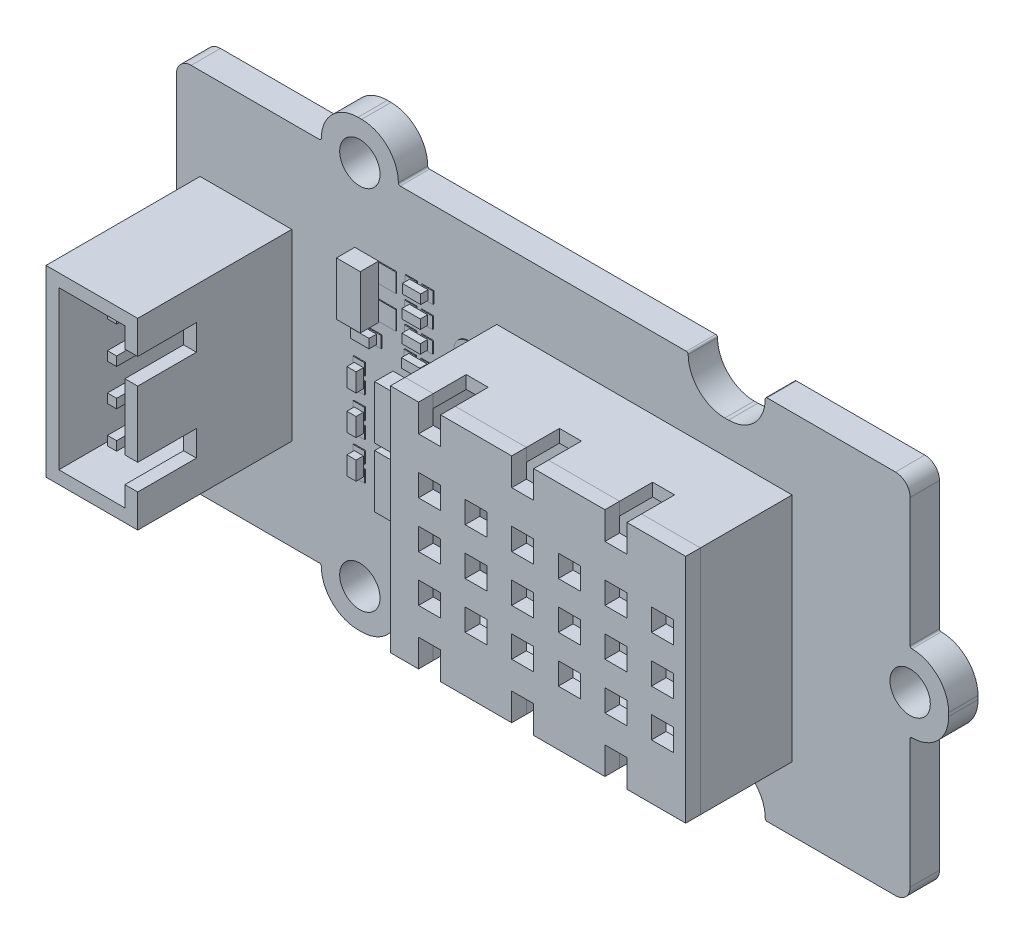
from build123d import *

# Parameters (mm, degrees)
ESQUISSE1_R                            = 1.1
ESQUISSE1_R_2                          = 0.4
ESQUISSE1_R_3                          = 0.4445
PCB_EAGLE_V2_1_EP_ESTIMEE_1_6_DEPTH    = 1.6
GROVE_VERTICAL_H_ESTIMEE_START         = 1.6
ESQUISSE2_W                            = 5
ESQUISSE2_H                            = 10
GROVE_VERTICAL_H_ESTIMEE_DEPTH         = 8.4
CAVITE_GROVE_START                     = 10
ESQUISSE3_W                            = 3.6
ESQUISSE3_H                            = 8.6
CAVITE_GROVE_DEPTH                     = 7.3
DETROMPEURS_GROVE_START                = 10
ESQUISSE4_W                            = 1
ESQUISSE4_H                            = 1.4
DETROMPEURS_GROVE_DEPTH                = 3.2
CONTACTS_GROVE_START                   = -0.8
ESQUISSE5_W                            = 0.5
ESQUISSE5_H                            = 0.5
CONTACTS_GROVE_DEPTH                   = 9.4
CONTACTS_GROVE_2_DEPTH                 = 9.4
CONTACTS_GROVE_3_DEPTH                 = 9.4
CONTACTS_GROVE_4_DEPTH                 = 9.4
DHT20_ENVELOPPE_16_1X12_6X5_8_START    = 1.8
ESQUISSE6_W                            = 16.1
ESQUISSE6_H                            = 12.6
DHT20_ENVELOPPE_16_1X12_6X5_8_DEPTH    = 5
DHT20_INTERIEUR_SIMPLIFIE_START        = 6.8
ESQUISSE7_W                            = 14.7
ESQUISSE7_H                            = 11.2
DHT20_INTERIEUR_SIMPLIFIE_DEPTH        = 4.4
DHT20_GRILLE_AERATION_SIMPLIFIEE_START = 6.8
ESQUISSE8_W                            = 16.1
ESQUISSE8_H                            = 12.6
ESQUISSE8_W_2                          = 1.2
ESQUISSE8_H_2                          = 1.2
DHT20_GRILLE_AERATION_SIMPLIFIEE_DEPTH = 0.8
DHT20_ENCOCHES_LATERALES_START         = 7.6
ESQUISSE9_W                            = 1.2
ESQUISSE9_H                            = 1.6
DHT20_ENCOCHES_LATERALES_DEPTH         = 2.6
PATTES_DHT20_HORIZONTALES_START        = 4.05
ESQUISSE10_W                           = 1.979
ESQUISSE10_H                           = 0.5
PATTES_DHT20_HORIZONTALES_DEPTH        = 0.3
PATTES_DHT20_HORIZONTALES_2_DEPTH      = 0.3
PATTES_DHT20_HORIZONTALES_3_DEPTH      = 0.3
PATTES_DHT20_HORIZONTALES_4_DEPTH      = 0.3
PATTES_DHT20_TRAVERSANTES_START        = -0.8
ESQUISSE11_W                           = 0.5
ESQUISSE11_H                           = 0.5
PATTES_DHT20_TRAVERSANTES_DEPTH        = 4.85
PATTES_DHT20_TRAVERSANTES_2_DEPTH      = 4.85
PATTES_DHT20_TRAVERSANTES_3_DEPTH      = 4.85
PATTES_DHT20_TRAVERSANTES_4_DEPTH      = 4.85
U14_POSITION_EAGLE_START               = 1.65
ESQUISSE12_W                           = 1.3
ESQUISSE12_H                           = 2.9
U14_POSITION_EAGLE_DEPTH               = 1
C62_POSITION_EAGLE_START               = 1.65
ESQUISSE13_W                           = 1
ESQUISSE13_H                           = 0.5
C62_POSITION_EAGLE_DEPTH               = 0.4
C65_POSITION_EAGLE_START               = 1.65
ESQUISSE14_W                           = 1
ESQUISSE14_H                           = 0.5
C65_POSITION_EAGLE_DEPTH               = 0.4
Q12_POSITION_EAGLE_START               = 1.65
ESQUISSE15_W                           = 1.3
ESQUISSE15_H                           = 2.9
Q12_POSITION_EAGLE_DEPTH               = 1
Q13_POSITION_EAGLE_START               = 1.65
ESQUISSE16_W                           = 1.3
ESQUISSE16_H                           = 2.9
Q13_POSITION_EAGLE_DEPTH               = 1
R65_POSITION_EAGLE_START               = 1.65
ESQUISSE17_W                           = 0.5
ESQUISSE17_H                           = 1
R65_POSITION_EAGLE_DEPTH               = 0.4
R66_POSITION_EAGLE_START               = 1.65
ESQUISSE18_W                           = 1
ESQUISSE18_H                           = 0.5
R66_POSITION_EAGLE_DEPTH               = 0.4
R67_POSITION_EAGLE_START               = 1.65
ESQUISSE19_W                           = 0.5
ESQUISSE19_H                           = 1
R67_POSITION_EAGLE_DEPTH               = 0.4
R68_POSITION_EAGLE_START               = 1.65
ESQUISSE20_W                           = 0.5
ESQUISSE20_H                           = 1
R68_POSITION_EAGLE_DEPTH               = 0.4
R53_POSITION_EAGLE_START               = 1.65
ESQUISSE21_W                           = 1
ESQUISSE21_H                           = 0.5
R53_POSITION_EAGLE_DEPTH               = 0.4
C54_POSITION_EAGLE_START               = 1.65
ESQUISSE22_W                           = 1
ESQUISSE22_H                           = 0.5
C54_POSITION_EAGLE_DEPTH               = 0.4
ANNEAU_J8_0_START                      = 1.6
ESQUISSE23_R                           = 0.635
ESQUISSE23_R_2                         = 0.4
ANNEAU_J8_0_DEPTH                      = 0.05
ANNEAU_J8_1_START                      = 1.6
ESQUISSE24_R                           = 0.635
ESQUISSE24_R_2                         = 0.4
ANNEAU_J8_1_DEPTH                      = 0.05
ANNEAU_J8_2_START                      = 1.6
ESQUISSE25_R                           = 0.635
ESQUISSE25_R_2                         = 0.4
ANNEAU_J8_2_DEPTH                      = 0.05
ANNEAU_J8_3_START                      = 1.6
ESQUISSE26_R                           = 0.635
ESQUISSE26_R_2                         = 0.4
ANNEAU_J8_3_DEPTH                      = 0.05
ANNEAU_U11_0_START                     = 1.6
ESQUISSE27_R                           = 0.762
ESQUISSE27_R_2                         = 0.4445
ANNEAU_U11_0_DEPTH                     = 0.05
ANNEAU_U11_1_START                     = 1.6
ESQUISSE28_R                           = 0.762
ESQUISSE28_R_2                         = 0.4445
ANNEAU_U11_1_DEPTH                     = 0.05
ANNEAU_U11_2_START                     = 1.6
ESQUISSE29_R                           = 0.762
ESQUISSE29_R_2                         = 0.4445
ANNEAU_U11_2_DEPTH                     = 0.05
ANNEAU_U11_3_START                     = 1.6
ESQUISSE30_R                           = 0.762
ESQUISSE30_R_2                         = 0.4445
ANNEAU_U11_3_DEPTH                     = 0.05
PAD_U14_0_START                        = 1.6
ESQUISSE31_W                           = 1.143
ESQUISSE31_H                           = 1.016
PAD_U14_0_DEPTH                        = 0.05
PAD_U14_1_START                        = 1.6
ESQUISSE32_W                           = 1.143
ESQUISSE32_H                           = 1.016
PAD_U14_1_DEPTH                        = 0.05
PAD_U14_2_START                        = 1.6
ESQUISSE33_W                           = 1.143
ESQUISSE33_H                           = 1.016
PAD_U14_2_DEPTH                        = 0.05
PAD_C62_0_START                        = 1.6
ESQUISSE34_W                           = 0.635
ESQUISSE34_H                           = 0.635
PAD_C62_0_DEPTH                        = 0.05
PAD_C62_1_START                        = 1.6
ESQUISSE35_W                           = 0.635
ESQUISSE35_H                           = 0.635
PAD_C62_1_DEPTH                        = 0.05
PAD_C65_0_START                        = 1.6
ESQUISSE36_W                           = 0.635
ESQUISSE36_H                           = 0.635
PAD_C65_0_DEPTH                        = 0.05
PAD_C65_1_START                        = 1.6
ESQUISSE37_W                           = 0.635
ESQUISSE37_H                           = 0.635
PAD_C65_1_DEPTH                        = 0.05
PAD_Q12_0_START                        = 1.6
ESQUISSE38_W                           = 1.143
ESQUISSE38_H                           = 1.016
PAD_Q12_0_DEPTH                        = 0.05
PAD_Q12_1_START                        = 1.6
ESQUISSE39_W                           = 1.143
ESQUISSE39_H                           = 1.016
PAD_Q12_1_DEPTH                        = 0.05
PAD_Q12_2_START                        = 1.6
ESQUISSE40_W                           = 1.143
ESQUISSE40_H                           = 1.016
PAD_Q12_2_DEPTH                        = 0.05
PAD_Q13_0_START                        = 1.6
ESQUISSE41_W                           = 1.143
ESQUISSE41_H                           = 1.016
PAD_Q13_0_DEPTH                        = 0.05
PAD_Q13_1_START                        = 1.6
ESQUISSE42_W                           = 1.143
ESQUISSE42_H                           = 1.016
PAD_Q13_1_DEPTH                        = 0.05
PAD_Q13_2_START                        = 1.6
ESQUISSE43_W                           = 1.143
ESQUISSE43_H                           = 1.016
PAD_Q13_2_DEPTH                        = 0.05
PAD_R65_0_START                        = 1.6
ESQUISSE44_W                           = 0.635
ESQUISSE44_H                           = 0.635
PAD_R65_0_DEPTH                        = 0.05
PAD_R65_1_START                        = 1.6
ESQUISSE45_W                           = 0.635
ESQUISSE45_H                           = 0.635
PAD_R65_1_DEPTH                        = 0.05
PAD_R66_0_START                        = 1.6
ESQUISSE46_W                           = 0.635
ESQUISSE46_H                           = 0.635
PAD_R66_0_DEPTH                        = 0.05
PAD_R66_1_START                        = 1.6
ESQUISSE47_W                           = 0.635
ESQUISSE47_H                           = 0.635
PAD_R66_1_DEPTH                        = 0.05
PAD_R67_0_START                        = 1.6
ESQUISSE48_W                           = 0.635
ESQUISSE48_H                           = 0.635
PAD_R67_0_DEPTH                        = 0.05
PAD_R67_1_START                        = 1.6
ESQUISSE49_W                           = 0.635
ESQUISSE49_H                           = 0.635
PAD_R67_1_DEPTH                        = 0.05
PAD_R68_0_START                        = 1.6
ESQUISSE50_W                           = 0.635
ESQUISSE50_H                           = 0.635
PAD_R68_0_DEPTH                        = 0.05
PAD_R68_1_START                        = 1.6
ESQUISSE51_W                           = 0.635
ESQUISSE51_H                           = 0.635
PAD_R68_1_DEPTH                        = 0.05
PAD_R53_0_START                        = 1.6
ESQUISSE52_W                           = 0.635
ESQUISSE52_H                           = 0.635
PAD_R53_0_DEPTH                        = 0.05
PAD_R53_1_START                        = 1.6
ESQUISSE53_W                           = 0.635
ESQUISSE53_H                           = 0.635
PAD_R53_1_DEPTH                        = 0.05
PAD_C54_0_START                        = 1.6
ESQUISSE54_W                           = 0.635
ESQUISSE54_H                           = 0.635
PAD_C54_0_DEPTH                        = 0.05
PAD_C54_1_START                        = 1.6
ESQUISSE55_W                           = 0.635
ESQUISSE55_H                           = 0.635
PAD_C54_1_DEPTH                        = 0.05


with BuildPart() as part:
    # Esquisse1 → PCB_Eagle_V2_1_ep_ESTIMEE_1_6 (new body)
    with BuildSketch(Plane.XY):
        with BuildLine():
            Line((-12.2, 10), (-19.2, 10))
            ThreePointArc((-19.2, 10), (-19.765685425, 9.765685425), (-20, 9.2))
            Line((-20, 9.2), (-20, 2.2))
            ThreePointArc((-20, 2.2), (-19.970710678, 2.129289322), (-19.9, 2.1))
            ThreePointArc((-19.9, 2.1), (-18.485786438, 1.514213562), (-17.9, 0.1))
            Line((-17.9, 0.1), (-17.9, -0.1))
            ThreePointArc((-17.9, -0.1), (-18.485786438, -1.514213562), (-19.9, -2.1))
            ThreePointArc((-19.9, -2.1), (-19.970710678, -2.129289322), (-20, -2.2))
            Line((-20, -2.2), (-20, -9.2))
            ThreePointArc((-20, -9.2), (-19.765685425, -9.765685425), (-19.2, -10))
            Line((-19.2, -10), (-12.2, -10))
            ThreePointArc((-12.2, -10), (-12.129289322, -10.029289322), (-12.1, -10.1))
            ThreePointArc((-12.1, -10.1), (-11.514213562, -11.514213562), (-10.1, -12.1))
            Line((-10.1, -12.1), (-9.9, -12.1))
            ThreePointArc((-9.9, -12.1), (-8.485786438, -11.514213562), (-7.9, -10.1))
            ThreePointArc((-7.9, -10.1), (-7.870710678, -10.029289322), (-7.8, -10))
            Line((-7.8, -10), (7.8, -10))
            ThreePointArc((7.8, -10), (7.870710678, -9.970710678), (7.9, -9.9))
            ThreePointArc((7.9, -9.9), (8.485786438, -8.485786438), (9.9, -7.9))
            Line((9.9, -7.9), (10.1, -7.9))
            ThreePointArc((10.1, -7.9), (11.514213562, -8.485786438), (12.1, -9.9))
            ThreePointArc((12.1, -9.9), (12.129289322, -9.970710678), (12.2, -10))
            Line((12.2, -10), (19.2, -10))
            ThreePointArc((19.2, -10), (19.765685425, -9.765685425), (20, -9.2))
            Line((20, -9.2), (20, -2.2))
            ThreePointArc((20, -2.2), (20.029289322, -2.129289322), (20.1, -2.1))
            ThreePointArc((20.1, -2.1), (21.514213562, -1.514213562), (22.1, -0.1))
            Line((22.1, -0.1), (22.1, 0.1))
            ThreePointArc((22.1, 0.1), (21.514213562, 1.514213562), (20.1, 2.1))
            ThreePointArc((20.1, 2.1), (20.029289322, 2.129289322), (20, 2.2))
            Line((20, 2.2), (20, 9.2))
            ThreePointArc((20, 9.2), (19.765685425, 9.765685425), (19.2, 10))
            Line((19.2, 10), (12.2, 10))
            ThreePointArc((12.2, 10), (12.129289322, 9.970710678), (12.1, 9.9))
            ThreePointArc((12.1, 9.9), (11.514213562, 8.485786438), (10.1, 7.9))
            Line((10.1, 7.9), (9.9, 7.9))
            ThreePointArc((9.9, 7.9), (8.485786438, 8.485786438), (7.9, 9.9))
            ThreePointArc((7.9, 9.9), (7.870710678, 9.970710678), (7.8, 10))
            Line((7.8, 10), (-7.8, 10))
            ThreePointArc((-7.8, 10), (-7.870710678, 10.029289322), (-7.9, 10.1))
            ThreePointArc((-7.9, 10.1), (-8.485786438, 11.514213562), (-9.9, 12.1))
            Line((-9.9, 12.1), (-10.1, 12.1))
            ThreePointArc((-10.1, 12.1), (-11.514213562, 11.514213562), (-12.1, 10.1))
            ThreePointArc((-12.1, 10.1), (-12.129289322, 10.029289322), (-12.2, 10))
        make_face()
        with Locations((-10, -10)):
            Circle(ESQUISSE1_R, mode=Mode.SUBTRACT)
        with Locations((-10, 10)):
            Circle(ESQUISSE1_R, mode=Mode.SUBTRACT)
        with Locations((20, 0)):
            Circle(ESQUISSE1_R, mode=Mode.SUBTRACT)
        with Locations((-16.51, -3)):
            Circle(ESQUISSE1_R_2, mode=Mode.SUBTRACT)
        with Locations((-16.51, -1)):
            Circle(ESQUISSE1_R_2, mode=Mode.SUBTRACT)
        with Locations((-16.51, 1)):
            Circle(ESQUISSE1_R_2, mode=Mode.SUBTRACT)
        with Locations((-16.51, 3)):
            Circle(ESQUISSE1_R_2, mode=Mode.SUBTRACT)
        with Locations((-4.064, 3.81)):
            Circle(ESQUISSE1_R_3, mode=Mode.SUBTRACT)
        with Locations((-4.064, 1.27)):
            Circle(ESQUISSE1_R_3, mode=Mode.SUBTRACT)
        with Locations((-4.064, -1.27)):
            Circle(ESQUISSE1_R_3, mode=Mode.SUBTRACT)
        with Locations((-4.064, -3.81)):
            Circle(ESQUISSE1_R_3, mode=Mode.SUBTRACT)
    extrude(amount=PCB_EAGLE_V2_1_EP_ESTIMEE_1_6_DEPTH)


with BuildPart() as body_2:
    # Esquisse2 → Grove_vertical_H_ESTIMEE (new body)
    with BuildSketch(Plane.XY.offset(GROVE_VERTICAL_H_ESTIMEE_START)):
        with Locations((-16.21, 0)):
            Rectangle(ESQUISSE2_W, ESQUISSE2_H)
    extrude(amount=GROVE_VERTICAL_H_ESTIMEE_DEPTH)

    # Esquisse3 → Cavite_Grove (cut)
    with BuildSketch(Plane.XY.offset(CAVITE_GROVE_START)):
        with Locations((-16.21, 0)):
            Rectangle(ESQUISSE3_W, ESQUISSE3_H)
    extrude(amount=-CAVITE_GROVE_DEPTH, mode=Mode.SUBTRACT)

    # Esquisse4 → Detrompeurs_Grove (cut)
    with BuildSketch(Plane.XY.offset(DETROMPEURS_GROVE_START)):
        with Locations((-14.01, -2.5)):
            Rectangle(ESQUISSE4_W, ESQUISSE4_H)
        with Locations((-14.01, 2.5)):
            Rectangle(ESQUISSE4_W, ESQUISSE4_H)
    extrude(amount=-DETROMPEURS_GROVE_DEPTH, mode=Mode.SUBTRACT)


with BuildPart() as body_3:
    # Esquisse5 → Contacts_Grove (new body)
    with BuildSketch(Plane.XY.offset(CONTACTS_GROVE_START)):
        with Locations((-16.51, -3)):
            Rectangle(ESQUISSE5_W, ESQUISSE5_H)
    extrude(amount=CONTACTS_GROVE_DEPTH)


with BuildPart() as body_4:
    # Esquisse5 → Contacts_Grove 2 (new body)
    with BuildSketch(Plane.XY.offset(CONTACTS_GROVE_START)):
        with Locations((-16.51, -1)):
            Rectangle(ESQUISSE5_W, ESQUISSE5_H)
    extrude(amount=CONTACTS_GROVE_2_DEPTH)


with BuildPart() as body_5:
    # Esquisse5 → Contacts_Grove 3 (new body)
    with BuildSketch(Plane.XY.offset(CONTACTS_GROVE_START)):
        with Locations((-16.51, 1)):
            Rectangle(ESQUISSE5_W, ESQUISSE5_H)
    extrude(amount=CONTACTS_GROVE_3_DEPTH)


with BuildPart() as body_6:
    # Esquisse5 → Contacts_Grove 4 (new body)
    with BuildSketch(Plane.XY.offset(CONTACTS_GROVE_START)):
        with Locations((-16.51, 3)):
            Rectangle(ESQUISSE5_W, ESQUISSE5_H)
    extrude(amount=CONTACTS_GROVE_4_DEPTH)


with BuildPart() as body_7:
    # Esquisse6 → DHT20_enveloppe_16_1x12_6x5_8 (new body)
    with BuildSketch(Plane.XY.offset(DHT20_ENVELOPPE_16_1X12_6X5_8_START)):
        with Locations((5.715, 0)):
            Rectangle(ESQUISSE6_W, ESQUISSE6_H)
    extrude(amount=DHT20_ENVELOPPE_16_1X12_6X5_8_DEPTH)

    # Esquisse7 → DHT20_interieur_simplifie (cut)
    with BuildSketch(Plane.XY.offset(DHT20_INTERIEUR_SIMPLIFIE_START)):
        with Locations((5.715, 0)):
            Rectangle(ESQUISSE7_W, ESQUISSE7_H)
    extrude(amount=-DHT20_INTERIEUR_SIMPLIFIE_DEPTH, mode=Mode.SUBTRACT)


with BuildPart() as body_8:
    # Esquisse8 → DHT20_grille_aeration_simplifiee (new body)
    with BuildSketch(Plane.XY.offset(DHT20_GRILLE_AERATION_SIMPLIFIEE_START)):
        with Locations((5.715, 0)):
            Rectangle(ESQUISSE8_W, ESQUISSE8_H)
        with Locations((-0.2, -2.7)):
            Rectangle(ESQUISSE8_W_2, ESQUISSE8_H_2, mode=Mode.SUBTRACT)
        with Locations((-0.2, -0.16)):
            Rectangle(ESQUISSE8_W_2, ESQUISSE8_H_2, mode=Mode.SUBTRACT)
        with Locations((-0.2, 2.38)):
            Rectangle(ESQUISSE8_W_2, ESQUISSE8_H_2, mode=Mode.SUBTRACT)
        with Locations((2.34, -2.7)):
            Rectangle(ESQUISSE8_W_2, ESQUISSE8_H_2, mode=Mode.SUBTRACT)
        with Locations((2.34, -0.16)):
            Rectangle(ESQUISSE8_W_2, ESQUISSE8_H_2, mode=Mode.SUBTRACT)
        with Locations((2.34, 2.38)):
            Rectangle(ESQUISSE8_W_2, ESQUISSE8_H_2, mode=Mode.SUBTRACT)
        with Locations((4.88, -2.7)):
            Rectangle(ESQUISSE8_W_2, ESQUISSE8_H_2, mode=Mode.SUBTRACT)
        with Locations((4.88, -0.16)):
            Rectangle(ESQUISSE8_W_2, ESQUISSE8_H_2, mode=Mode.SUBTRACT)
        with Locations((4.88, 2.38)):
            Rectangle(ESQUISSE8_W_2, ESQUISSE8_H_2, mode=Mode.SUBTRACT)
        with Locations((7.42, -2.7)):
            Rectangle(ESQUISSE8_W_2, ESQUISSE8_H_2, mode=Mode.SUBTRACT)
        with Locations((7.42, -0.16)):
            Rectangle(ESQUISSE8_W_2, ESQUISSE8_H_2, mode=Mode.SUBTRACT)
        with Locations((7.42, 2.38)):
            Rectangle(ESQUISSE8_W_2, ESQUISSE8_H_2, mode=Mode.SUBTRACT)
        with Locations((9.96, -2.7)):
            Rectangle(ESQUISSE8_W_2, ESQUISSE8_H_2, mode=Mode.SUBTRACT)
        with Locations((9.96, -0.16)):
            Rectangle(ESQUISSE8_W_2, ESQUISSE8_H_2, mode=Mode.SUBTRACT)
        with Locations((9.96, 2.38)):
            Rectangle(ESQUISSE8_W_2, ESQUISSE8_H_2, mode=Mode.SUBTRACT)
        with Locations((12.5, -2.7)):
            Rectangle(ESQUISSE8_W_2, ESQUISSE8_H_2, mode=Mode.SUBTRACT)
        with Locations((12.5, -0.16)):
            Rectangle(ESQUISSE8_W_2, ESQUISSE8_H_2, mode=Mode.SUBTRACT)
        with Locations((12.5, 2.38)):
            Rectangle(ESQUISSE8_W_2, ESQUISSE8_H_2, mode=Mode.SUBTRACT)
    extrude(amount=DHT20_GRILLE_AERATION_SIMPLIFIEE_DEPTH)


with BuildPart() as dht20_encoches_laterales_tool:
    # Esquisse9 → DHT20_encoches_laterales (new body)
    with BuildSketch(Plane.XY.offset(DHT20_ENCOCHES_LATERALES_START)):
        with Locations((-0.2, -5.6)):
            Rectangle(ESQUISSE9_W, ESQUISSE9_H)
        with Locations((-0.2, 5.6)):
            Rectangle(ESQUISSE9_W, ESQUISSE9_H)
        with Locations((4.88, -5.6)):
            Rectangle(ESQUISSE9_W, ESQUISSE9_H)
        with Locations((4.88, 5.6)):
            Rectangle(ESQUISSE9_W, ESQUISSE9_H)
        with Locations((9.96, -5.6)):
            Rectangle(ESQUISSE9_W, ESQUISSE9_H)
        with Locations((9.96, 5.6)):
            Rectangle(ESQUISSE9_W, ESQUISSE9_H)
    extrude(amount=-DHT20_ENCOCHES_LATERALES_DEPTH)


with BuildPart() as body_7_1:
    add(body_7.part)

    # DHT20_encoches_laterales: cut by dht20_encoches_laterales_tool
    add(dht20_encoches_laterales_tool.part, mode=Mode.SUBTRACT)


with BuildPart() as body_8_1:
    add(body_8.part)

    # DHT20_encoches_laterales: cut by dht20_encoches_laterales_tool
    add(dht20_encoches_laterales_tool.part, mode=Mode.SUBTRACT)


with BuildPart() as body_9:
    # Esquisse10 → Pattes_DHT20_horizontales (new body)
    with BuildSketch(Plane.XY.offset(PATTES_DHT20_HORIZONTALES_START)):
        with Locations((-3.3245, -3.81)):
            Rectangle(ESQUISSE10_W, ESQUISSE10_H)
    extrude(amount=PATTES_DHT20_HORIZONTALES_DEPTH)


with BuildPart() as body_10:
    # Esquisse10 → Pattes_DHT20_horizontales 2 (new body)
    with BuildSketch(Plane.XY.offset(PATTES_DHT20_HORIZONTALES_START)):
        with Locations((-3.3245, -1.27)):
            Rectangle(ESQUISSE10_W, ESQUISSE10_H)
    extrude(amount=PATTES_DHT20_HORIZONTALES_2_DEPTH)


with BuildPart() as body_11:
    # Esquisse10 → Pattes_DHT20_horizontales 3 (new body)
    with BuildSketch(Plane.XY.offset(PATTES_DHT20_HORIZONTALES_START)):
        with Locations((-3.3245, 1.27)):
            Rectangle(ESQUISSE10_W, ESQUISSE10_H)
    extrude(amount=PATTES_DHT20_HORIZONTALES_3_DEPTH)


with BuildPart() as body_12:
    # Esquisse10 → Pattes_DHT20_horizontales 4 (new body)
    with BuildSketch(Plane.XY.offset(PATTES_DHT20_HORIZONTALES_START)):
        with Locations((-3.3245, 3.81)):
            Rectangle(ESQUISSE10_W, ESQUISSE10_H)
    extrude(amount=PATTES_DHT20_HORIZONTALES_4_DEPTH)


with BuildPart() as body_13:
    # Esquisse11 → Pattes_DHT20_traversantes (new body)
    with BuildSketch(Plane.XY.offset(PATTES_DHT20_TRAVERSANTES_START)):
        with Locations((-4.064, -3.81)):
            Rectangle(ESQUISSE11_W, ESQUISSE11_H)
    extrude(amount=PATTES_DHT20_TRAVERSANTES_DEPTH)


with BuildPart() as body_14:
    # Esquisse11 → Pattes_DHT20_traversantes 2 (new body)
    with BuildSketch(Plane.XY.offset(PATTES_DHT20_TRAVERSANTES_START)):
        with Locations((-4.064, -1.27)):
            Rectangle(ESQUISSE11_W, ESQUISSE11_H)
    extrude(amount=PATTES_DHT20_TRAVERSANTES_2_DEPTH)


with BuildPart() as body_15:
    # Esquisse11 → Pattes_DHT20_traversantes 3 (new body)
    with BuildSketch(Plane.XY.offset(PATTES_DHT20_TRAVERSANTES_START)):
        with Locations((-4.064, 1.27)):
            Rectangle(ESQUISSE11_W, ESQUISSE11_H)
    extrude(amount=PATTES_DHT20_TRAVERSANTES_3_DEPTH)


with BuildPart() as body_16:
    # Esquisse11 → Pattes_DHT20_traversantes 4 (new body)
    with BuildSketch(Plane.XY.offset(PATTES_DHT20_TRAVERSANTES_START)):
        with Locations((-4.064, 3.81)):
            Rectangle(ESQUISSE11_W, ESQUISSE11_H)
    extrude(amount=PATTES_DHT20_TRAVERSANTES_4_DEPTH)


with BuildPart() as body_17:
    # Esquisse12 → U14_position_Eagle (new body)
    with BuildSketch(Plane.XY.offset(U14_POSITION_EAGLE_START)):
        with Locations((-9.5758, 4.4704)):
            Rectangle(ESQUISSE12_W, ESQUISSE12_H)
    extrude(amount=U14_POSITION_EAGLE_DEPTH)


with BuildPart() as body_18:
    # Esquisse13 → C62_position_Eagle (new body)
    with BuildSketch(Plane.XY.offset(C62_POSITION_EAGLE_START)):
        with Locations((-9.5504, 2.159)):
            Rectangle(ESQUISSE13_W, ESQUISSE13_H)
    extrude(amount=C62_POSITION_EAGLE_DEPTH)


with BuildPart() as body_19:
    # Esquisse14 → C65_position_Eagle (new body)
    with BuildSketch(Plane.XY.offset(C65_POSITION_EAGLE_START)):
        with Locations((-6.731, 5.6642)):
            Rectangle(ESQUISSE14_W, ESQUISSE14_H)
    extrude(amount=C65_POSITION_EAGLE_DEPTH)


with BuildPart() as body_20:
    # Esquisse15 → Q12_position_Eagle (new body)
    with BuildSketch(Plane.XY.offset(Q12_POSITION_EAGLE_START)):
        with Locations((-7.493, -0.3302)):
            Rectangle(ESQUISSE15_W, ESQUISSE15_H)
    extrude(amount=Q12_POSITION_EAGLE_DEPTH)


with BuildPart() as body_21:
    # Esquisse16 → Q13_position_Eagle (new body)
    with BuildSketch(Plane.XY.offset(Q13_POSITION_EAGLE_START)):
        with Locations((-7.493, -3.5814)):
            Rectangle(ESQUISSE16_W, ESQUISSE16_H)
    extrude(amount=Q13_POSITION_EAGLE_DEPTH)


with BuildPart() as body_22:
    # Esquisse17 → R65_position_Eagle (new body)
    with BuildSketch(Plane.XY.offset(R65_POSITION_EAGLE_START)):
        with Locations((-10.0076, -4.191)):
            Rectangle(ESQUISSE17_W, ESQUISSE17_H)
    extrude(amount=R65_POSITION_EAGLE_DEPTH)


with BuildPart() as body_23:
    # Esquisse18 → R66_position_Eagle (new body)
    with BuildSketch(Plane.XY.offset(R66_POSITION_EAGLE_START)):
        with Locations((-6.7818, 2.1336)):
            Rectangle(ESQUISSE18_W, ESQUISSE18_H)
    extrude(amount=R66_POSITION_EAGLE_DEPTH)


with BuildPart() as body_24:
    # Esquisse19 → R67_position_Eagle (new body)
    with BuildSketch(Plane.XY.offset(R67_POSITION_EAGLE_START)):
        with Locations((-10.0076, -2.1336)):
            Rectangle(ESQUISSE19_W, ESQUISSE19_H)
    extrude(amount=R67_POSITION_EAGLE_DEPTH)


with BuildPart() as body_25:
    # Esquisse20 → R68_position_Eagle (new body)
    with BuildSketch(Plane.XY.offset(R68_POSITION_EAGLE_START)):
        with Locations((-10.0076, -0.0254)):
            Rectangle(ESQUISSE20_W, ESQUISSE20_H)
    extrude(amount=R68_POSITION_EAGLE_DEPTH)


with BuildPart() as body_26:
    # Esquisse21 → R53_position_Eagle (new body)
    with BuildSketch(Plane.XY.offset(R53_POSITION_EAGLE_START)):
        with Locations((-6.7564, 4.4704)):
            Rectangle(ESQUISSE21_W, ESQUISSE21_H)
    extrude(amount=R53_POSITION_EAGLE_DEPTH)


with BuildPart() as body_27:
    # Esquisse22 → C54_position_Eagle (new body)
    with BuildSketch(Plane.XY.offset(C54_POSITION_EAGLE_START)):
        with Locations((-6.7564, 3.302)):
            Rectangle(ESQUISSE22_W, ESQUISSE22_H)
    extrude(amount=C54_POSITION_EAGLE_DEPTH)


with BuildPart() as body_28:
    # Esquisse23 → Anneau_J8_0 (new body)
    with BuildSketch(Plane.XY.offset(ANNEAU_J8_0_START)):
        with Locations((-16.51, -3)):
            Circle(ESQUISSE23_R)
        with Locations((-16.51, -3)):
            Circle(ESQUISSE23_R_2, mode=Mode.SUBTRACT)
    extrude(amount=ANNEAU_J8_0_DEPTH)


with BuildPart() as body_29:
    # Esquisse24 → Anneau_J8_1 (new body)
    with BuildSketch(Plane.XY.offset(ANNEAU_J8_1_START)):
        with Locations((-16.51, -1)):
            Circle(ESQUISSE24_R)
        with Locations((-16.51, -1)):
            Circle(ESQUISSE24_R_2, mode=Mode.SUBTRACT)
    extrude(amount=ANNEAU_J8_1_DEPTH)


with BuildPart() as body_30:
    # Esquisse25 → Anneau_J8_2 (new body)
    with BuildSketch(Plane.XY.offset(ANNEAU_J8_2_START)):
        with Locations((-16.51, 1)):
            Circle(ESQUISSE25_R)
        with Locations((-16.51, 1)):
            Circle(ESQUISSE25_R_2, mode=Mode.SUBTRACT)
    extrude(amount=ANNEAU_J8_2_DEPTH)


with BuildPart() as body_31:
    # Esquisse26 → Anneau_J8_3 (new body)
    with BuildSketch(Plane.XY.offset(ANNEAU_J8_3_START)):
        with Locations((-16.51, 3)):
            Circle(ESQUISSE26_R)
        with Locations((-16.51, 3)):
            Circle(ESQUISSE26_R_2, mode=Mode.SUBTRACT)
    extrude(amount=ANNEAU_J8_3_DEPTH)


with BuildPart() as body_32:
    # Esquisse27 → Anneau_U11_0 (new body)
    with BuildSketch(Plane.XY.offset(ANNEAU_U11_0_START)):
        with Locations((-4.064, 3.81)):
            Circle(ESQUISSE27_R)
        with Locations((-4.064, 3.81)):
            Circle(ESQUISSE27_R_2, mode=Mode.SUBTRACT)
    extrude(amount=ANNEAU_U11_0_DEPTH)


with BuildPart() as body_33:
    # Esquisse28 → Anneau_U11_1 (new body)
    with BuildSketch(Plane.XY.offset(ANNEAU_U11_1_START)):
        with Locations((-4.064, 1.27)):
            Circle(ESQUISSE28_R)
        with Locations((-4.064, 1.27)):
            Circle(ESQUISSE28_R_2, mode=Mode.SUBTRACT)
    extrude(amount=ANNEAU_U11_1_DEPTH)


with BuildPart() as body_34:
    # Esquisse29 → Anneau_U11_2 (new body)
    with BuildSketch(Plane.XY.offset(ANNEAU_U11_2_START)):
        with Locations((-4.064, -1.27)):
            Circle(ESQUISSE29_R)
        with Locations((-4.064, -1.27)):
            Circle(ESQUISSE29_R_2, mode=Mode.SUBTRACT)
    extrude(amount=ANNEAU_U11_2_DEPTH)


with BuildPart() as body_35:
    # Esquisse30 → Anneau_U11_3 (new body)
    with BuildSketch(Plane.XY.offset(ANNEAU_U11_3_START)):
        with Locations((-4.064, -3.81)):
            Circle(ESQUISSE30_R)
        with Locations((-4.064, -3.81)):
            Circle(ESQUISSE30_R_2, mode=Mode.SUBTRACT)
    extrude(amount=ANNEAU_U11_3_DEPTH)


with BuildPart() as body_36:
    # Esquisse31 → Pad_U14_0 (new body)
    with BuildSketch(Plane.XY.offset(PAD_U14_0_START)):
        with Locations((-10.5918, 4.4704)):
            Rectangle(ESQUISSE31_W, ESQUISSE31_H)
    extrude(amount=PAD_U14_0_DEPTH)


with BuildPart() as body_37:
    # Esquisse32 → Pad_U14_1 (new body)
    with BuildSketch(Plane.XY.offset(PAD_U14_1_START)):
        with Locations((-8.5598, 5.3594)):
            Rectangle(ESQUISSE32_W, ESQUISSE32_H)
    extrude(amount=PAD_U14_1_DEPTH)


with BuildPart() as body_38:
    # Esquisse33 → Pad_U14_2 (new body)
    with BuildSketch(Plane.XY.offset(PAD_U14_2_START)):
        with Locations((-8.5598, 3.5814)):
            Rectangle(ESQUISSE33_W, ESQUISSE33_H)
    extrude(amount=PAD_U14_2_DEPTH)


with BuildPart() as body_39:
    # Esquisse34 → Pad_C62_0 (new body)
    with BuildSketch(Plane.XY.offset(PAD_C62_0_START)):
        with Locations((-9.9949, 2.159)):
            Rectangle(ESQUISSE34_W, ESQUISSE34_H)
    extrude(amount=PAD_C62_0_DEPTH)


with BuildPart() as body_40:
    # Esquisse35 → Pad_C62_1 (new body)
    with BuildSketch(Plane.XY.offset(PAD_C62_1_START)):
        with Locations((-9.1059, 2.159)):
            Rectangle(ESQUISSE35_W, ESQUISSE35_H)
    extrude(amount=PAD_C62_1_DEPTH)


with BuildPart() as body_41:
    # Esquisse36 → Pad_C65_0 (new body)
    with BuildSketch(Plane.XY.offset(PAD_C65_0_START)):
        with Locations((-7.1755, 5.6642)):
            Rectangle(ESQUISSE36_W, ESQUISSE36_H)
    extrude(amount=PAD_C65_0_DEPTH)


with BuildPart() as body_42:
    # Esquisse37 → Pad_C65_1 (new body)
    with BuildSketch(Plane.XY.offset(PAD_C65_1_START)):
        with Locations((-6.2865, 5.6642)):
            Rectangle(ESQUISSE37_W, ESQUISSE37_H)
    extrude(amount=PAD_C65_1_DEPTH)


with BuildPart() as body_43:
    # Esquisse38 → Pad_Q12_0 (new body)
    with BuildSketch(Plane.XY.offset(PAD_Q12_0_START)):
        with Locations((-8.509, -0.3302)):
            Rectangle(ESQUISSE38_W, ESQUISSE38_H)
    extrude(amount=PAD_Q12_0_DEPTH)


with BuildPart() as body_44:
    # Esquisse39 → Pad_Q12_1 (new body)
    with BuildSketch(Plane.XY.offset(PAD_Q12_1_START)):
        with Locations((-6.477, 0.5588)):
            Rectangle(ESQUISSE39_W, ESQUISSE39_H)
    extrude(amount=PAD_Q12_1_DEPTH)


with BuildPart() as body_45:
    # Esquisse40 → Pad_Q12_2 (new body)
    with BuildSketch(Plane.XY.offset(PAD_Q12_2_START)):
        with Locations((-6.477, -1.2192)):
            Rectangle(ESQUISSE40_W, ESQUISSE40_H)
    extrude(amount=PAD_Q12_2_DEPTH)


with BuildPart() as body_46:
    # Esquisse41 → Pad_Q13_0 (new body)
    with BuildSketch(Plane.XY.offset(PAD_Q13_0_START)):
        with Locations((-8.509, -3.5814)):
            Rectangle(ESQUISSE41_W, ESQUISSE41_H)
    extrude(amount=PAD_Q13_0_DEPTH)


with BuildPart() as body_47:
    # Esquisse42 → Pad_Q13_1 (new body)
    with BuildSketch(Plane.XY.offset(PAD_Q13_1_START)):
        with Locations((-6.477, -2.6924)):
            Rectangle(ESQUISSE42_W, ESQUISSE42_H)
    extrude(amount=PAD_Q13_1_DEPTH)


with BuildPart() as body_48:
    # Esquisse43 → Pad_Q13_2 (new body)
    with BuildSketch(Plane.XY.offset(PAD_Q13_2_START)):
        with Locations((-6.477, -4.4704)):
            Rectangle(ESQUISSE43_W, ESQUISSE43_H)
    extrude(amount=PAD_Q13_2_DEPTH)


with BuildPart() as body_49:
    # Esquisse44 → Pad_R65_0 (new body)
    with BuildSketch(Plane.XY.offset(PAD_R65_0_START)):
        with Locations((-10.0076, -4.6355)):
            Rectangle(ESQUISSE44_W, ESQUISSE44_H)
    extrude(amount=PAD_R65_0_DEPTH)


with BuildPart() as body_50:
    # Esquisse45 → Pad_R65_1 (new body)
    with BuildSketch(Plane.XY.offset(PAD_R65_1_START)):
        with Locations((-10.0076, -3.7465)):
            Rectangle(ESQUISSE45_W, ESQUISSE45_H)
    extrude(amount=PAD_R65_1_DEPTH)


with BuildPart() as body_51:
    # Esquisse46 → Pad_R66_0 (new body)
    with BuildSketch(Plane.XY.offset(PAD_R66_0_START)):
        with Locations((-7.2263, 2.1336)):
            Rectangle(ESQUISSE46_W, ESQUISSE46_H)
    extrude(amount=PAD_R66_0_DEPTH)


with BuildPart() as body_52:
    # Esquisse47 → Pad_R66_1 (new body)
    with BuildSketch(Plane.XY.offset(PAD_R66_1_START)):
        with Locations((-6.3373, 2.1336)):
            Rectangle(ESQUISSE47_W, ESQUISSE47_H)
    extrude(amount=PAD_R66_1_DEPTH)


with BuildPart() as body_53:
    # Esquisse48 → Pad_R67_0 (new body)
    with BuildSketch(Plane.XY.offset(PAD_R67_0_START)):
        with Locations((-10.0076, -1.6891)):
            Rectangle(ESQUISSE48_W, ESQUISSE48_H)
    extrude(amount=PAD_R67_0_DEPTH)


with BuildPart() as body_54:
    # Esquisse49 → Pad_R67_1 (new body)
    with BuildSketch(Plane.XY.offset(PAD_R67_1_START)):
        with Locations((-10.0076, -2.5781)):
            Rectangle(ESQUISSE49_W, ESQUISSE49_H)
    extrude(amount=PAD_R67_1_DEPTH)


with BuildPart() as body_55:
    # Esquisse50 → Pad_R68_0 (new body)
    with BuildSketch(Plane.XY.offset(PAD_R68_0_START)):
        with Locations((-10.0076, 0.4191)):
            Rectangle(ESQUISSE50_W, ESQUISSE50_H)
    extrude(amount=PAD_R68_0_DEPTH)


with BuildPart() as body_56:
    # Esquisse51 → Pad_R68_1 (new body)
    with BuildSketch(Plane.XY.offset(PAD_R68_1_START)):
        with Locations((-10.0076, -0.4699)):
            Rectangle(ESQUISSE51_W, ESQUISSE51_H)
    extrude(amount=PAD_R68_1_DEPTH)


with BuildPart() as body_57:
    # Esquisse52 → Pad_R53_0 (new body)
    with BuildSketch(Plane.XY.offset(PAD_R53_0_START)):
        with Locations((-6.3119, 4.4704)):
            Rectangle(ESQUISSE52_W, ESQUISSE52_H)
    extrude(amount=PAD_R53_0_DEPTH)


with BuildPart() as body_58:
    # Esquisse53 → Pad_R53_1 (new body)
    with BuildSketch(Plane.XY.offset(PAD_R53_1_START)):
        with Locations((-7.2009, 4.4704)):
            Rectangle(ESQUISSE53_W, ESQUISSE53_H)
    extrude(amount=PAD_R53_1_DEPTH)


with BuildPart() as body_59:
    # Esquisse54 → Pad_C54_0 (new body)
    with BuildSketch(Plane.XY.offset(PAD_C54_0_START)):
        with Locations((-7.2009, 3.302)):
            Rectangle(ESQUISSE54_W, ESQUISSE54_H)
    extrude(amount=PAD_C54_0_DEPTH)


with BuildPart() as body_60:
    # Esquisse55 → Pad_C54_1 (new body)
    with BuildSketch(Plane.XY.offset(PAD_C54_1_START)):
        with Locations((-6.3119, 3.302)):
            Rectangle(ESQUISSE55_W, ESQUISSE55_H)
    extrude(amount=PAD_C54_1_DEPTH)


solid = Compound([part.part, body_2.part, body_3.part, body_4.part, body_5.part, body_6.part, body_7_1.part, body_8_1.part, body_9.part, body_10.part, body_11.part, body_12.part, body_13.part, body_14.part, body_15.part, body_16.part, body_17.part, body_18.part, body_19.part, body_20.part, body_21.part, body_22.part, body_23.part, body_24.part, body_25.part, body_26.part, body_27.part, body_28.part, body_29.part, body_30.part, body_31.part, body_32.part, body_33.part, body_34.part, body_35.part, body_36.part, body_37.part, body_38.part, body_39.part, body_40.part, body_41.part, body_42.part, body_43.part, body_44.part, body_45.part, body_46.part, body_47.part, body_48.part, body_49.part, body_50.part, body_51.part, body_52.part, body_53.part, body_54.part, body_55.part, body_56.part, body_57.part, body_58.part, body_59.part, body_60.part])
